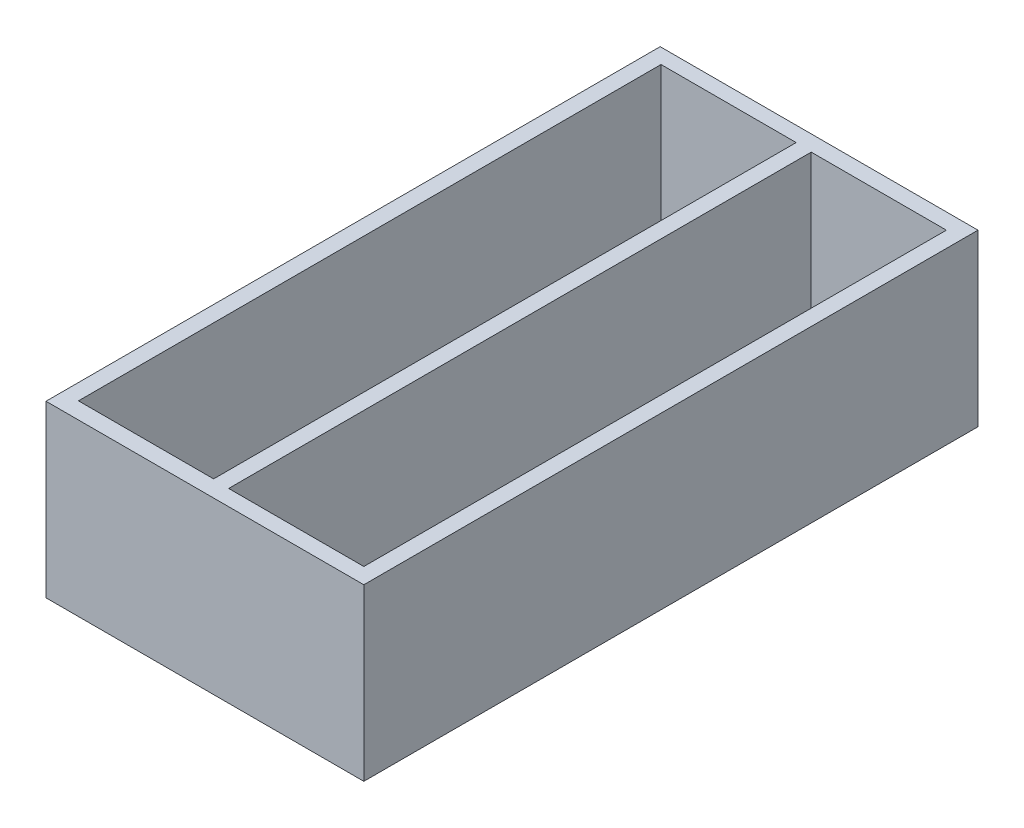
from build123d import *

# Parameters (mm, degrees)
SKETCH1_W           = 40.21
SKETCH1_H           = 77.7
BOSS_EXTRUDE1_DEPTH = 21.54
SKETCH2_W           = 17.1
SKETCH2_H           = 73.7
CUT_EXTRUDE1_DEPTH  = 19.54


with BuildPart() as part:
    # Sketch1 → Boss-Extrude1 (new body)
    with BuildSketch(Plane(origin=(0, 0, 0), x_dir=(1, 0, 0), z_dir=(0, 1, 0))):
        with Locations((-7.596730769, 20.466634615)):
            Rectangle(SKETCH1_W, SKETCH1_H)
    extrude(amount=BOSS_EXTRUDE1_DEPTH)

    # Sketch2 → Cut-Extrude1 (cut)
    with BuildSketch(Plane(origin=(0, 21.54, 0), x_dir=(1, 0, 0), z_dir=(0, 1, 0))):
        with Locations((1.958269231, 20.466634615)):
            Rectangle(SKETCH2_W, SKETCH2_H)
        with Locations((-17.141730769, 20.564505514)):
            Rectangle(SKETCH2_W, SKETCH2_H)
    extrude(amount=-CUT_EXTRUDE1_DEPTH, mode=Mode.SUBTRACT)


solid = part.part
